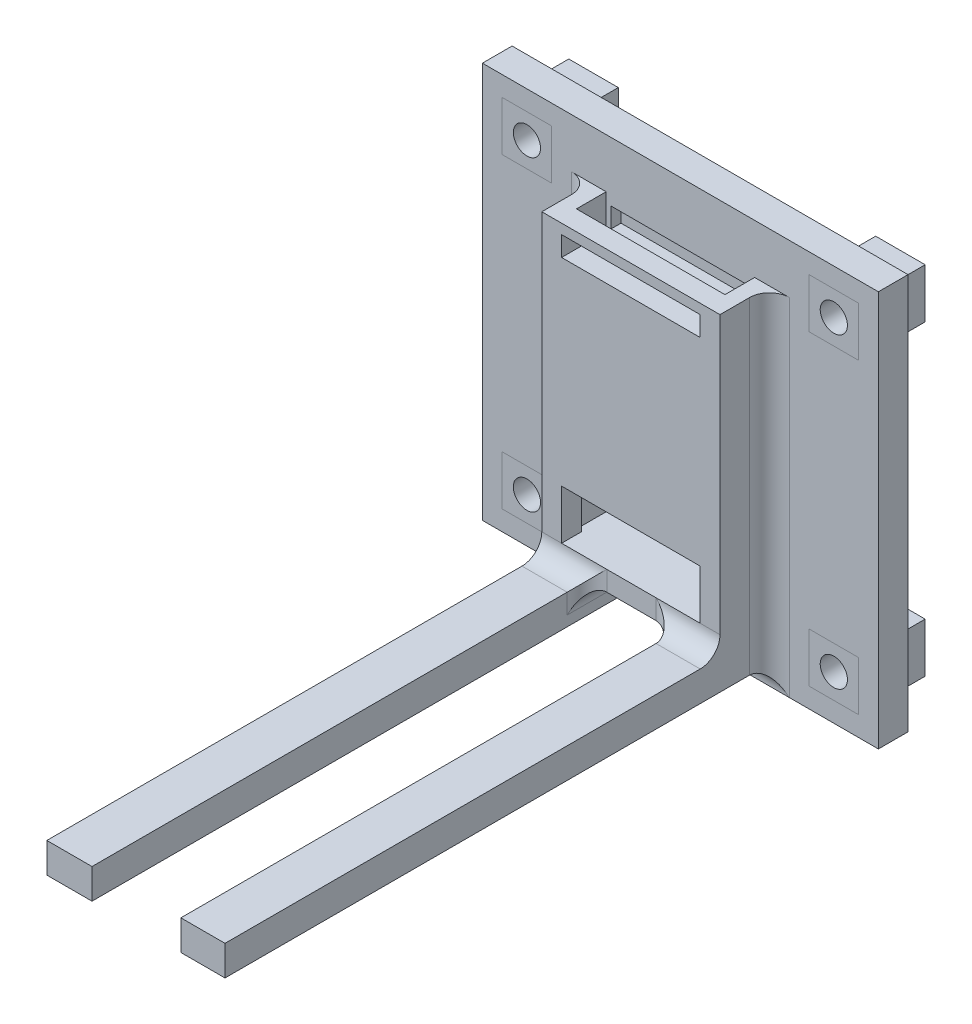
from build123d import *
from OCP.BRepAlgoAPI import BRepAlgoAPI_Cut
from OCP.TopTools import TopTools_ListOfShape

# Parameters (mm, degrees)
SKETCH1_W             = 40
SKETCH1_H             = 40
SKETCH1_W_2           = 5
SKETCH1_H_2           = 5
BOSS_EXTRUDE1_DEPTH   = 1.5
BOSS_EXTRUDE2_START   = 1.5
SKETCH1_3_W           = 5
SKETCH1_3_H           = 5
SKETCH1_3_R           = 1.375
BOSS_EXTRUDE2_DEPTH   = 6.728027623
BOSS_EXTRUDE2_2_DEPTH = 6.728027623
BOSS_EXTRUDE2_3_DEPTH = 6.728027623
BOSS_EXTRUDE2_4_DEPTH = 6.728027623
SKETCH2_W             = 18
SKETCH2_H             = 5
BOSS_EXTRUDE3_DEPTH   = 15
CUT_EXTRUDE1_START    = -13
SKETCH2_3_W           = 15
SKETCH2_3_H           = 3
CUT_EXTRUDE1_DEPTH    = 28
BOSS_EXTRUDE4_START   = 1.5
SKETCH5_W             = 4.563741623
SKETCH5_H             = 3.034118579
SKETCH5_W_2           = 4.459037602
BOSS_EXTRUDE4_DEPTH   = 55
CUT_EXTRUDE2_START    = 6.5
SKETCH5_3_W           = 14
SKETCH5_3_H           = 2
CUT_EXTRUDE2_DEPTH    = 6
CUT_EXTRUDE3_START    = 6.5
SKETCH5_4_W           = 14
SKETCH5_4_H           = 5
CUT_EXTRUDE3_DEPTH    = 5
FILLET2_START         = -9
FILLET2_DEPTH         = 18
FILLET2_START_2       = -20.000000802
FILLET2_2_DEPTH       = 7.000000802
FILLET2_START_3       = -15
FILLET2_3_DEPTH       = 30
FILLET2_START_4       = -12
FILLET2_4_DEPTH       = 24
FILLET2_5_DEPTH       = 4.563741623
FILLET2_START_5       = 4.540962398
FILLET2_6_DEPTH       = 4.459037602
FILLET3_R             = 2


with BuildPart() as part:
    # Sketch1 → Boss-Extrude1 (new, symmetric)
    with BuildSketch(Plane.XY):
        Rectangle(SKETCH1_W, SKETCH1_H)
        with Locations((-15.5, -15.5)):
            Rectangle(SKETCH1_W_2, SKETCH1_H_2, mode=Mode.SUBTRACT)
        with Locations((15.5, -15.5)):
            Rectangle(SKETCH1_W_2, SKETCH1_H_2, mode=Mode.SUBTRACT)
        with Locations((15.5, 15.5)):
            Rectangle(SKETCH1_W_2, SKETCH1_H_2, mode=Mode.SUBTRACT)
        with Locations((-15.5, 15.5)):
            Rectangle(SKETCH1_W_2, SKETCH1_H_2, mode=Mode.SUBTRACT)
    extrude(amount=BOSS_EXTRUDE1_DEPTH, both=True)

    # Sketch2 → Boss-Extrude3 (add, symmetric)
    with BuildSketch(Plane(origin=(0, 0, 0), x_dir=(1, 0, 0), z_dir=(0, 1, 0))):
        with Locations((0, -4)):
            Rectangle(SKETCH2_W, SKETCH2_H)
    extrude(amount=BOSS_EXTRUDE3_DEPTH, both=True)

    # Sketch2<3> → Cut-Extrude1 (cut)
    with BuildSketch(Plane(origin=(0, 0, 0), x_dir=(1, 0, 0), z_dir=(0, 1, 0)).offset(CUT_EXTRUDE1_START)):
        with Locations((0, -3)):
            Rectangle(SKETCH2_3_W, SKETCH2_3_H)
    extrude(amount=CUT_EXTRUDE1_DEPTH, mode=Mode.SUBTRACT)

    # Sketch5 → Boss-Extrude4 (add)
    with BuildSketch(Plane.XY.offset(BOSS_EXTRUDE4_START)):
        with Locations((-6.718129189, -16.51705929)):
            Rectangle(SKETCH5_W, SKETCH5_H)
        with Locations((6.770481199, -16.51705929)):
            Rectangle(SKETCH5_W_2, SKETCH5_H)
    extrude(amount=BOSS_EXTRUDE4_DEPTH)

    # Sketch5<3> → Cut-Extrude2 (cut)
    with BuildSketch(Plane.XY.offset(CUT_EXTRUDE2_START)):
        with Locations((0, 13)):
            Rectangle(SKETCH5_3_W, SKETCH5_3_H)
    extrude(amount=-CUT_EXTRUDE2_DEPTH, mode=Mode.SUBTRACT)

    # Sketch5<4> → Cut-Extrude3 (cut)
    with BuildSketch(Plane.XY.offset(CUT_EXTRUDE3_START)):
        with Locations((0, -10.5)):
            Rectangle(SKETCH5_4_W, SKETCH5_4_H)
    extrude(amount=-CUT_EXTRUDE3_DEPTH, mode=Mode.SUBTRACT)


with BuildPart() as body_2:
    # Sketch1<3> → Boss-Extrude2 (new body)
    with BuildSketch(Plane.XY.offset(BOSS_EXTRUDE2_START)):
        with Locations((-15.5, -15.5)):
            Rectangle(SKETCH1_3_W, SKETCH1_3_H)
        with Locations((-15.5, -15.5)):
            Circle(SKETCH1_3_R, mode=Mode.SUBTRACT)
    extrude(amount=-BOSS_EXTRUDE2_DEPTH)


with BuildPart() as body_3:
    # Sketch1<3> → Boss-Extrude2 2 (new body)
    with BuildSketch(Plane.XY.offset(BOSS_EXTRUDE2_START)):
        with Locations((15.5, -15.5)):
            Rectangle(SKETCH1_3_W, SKETCH1_3_H)
        with Locations((15.5, -15.5)):
            Circle(SKETCH1_3_R, mode=Mode.SUBTRACT)
    extrude(amount=-BOSS_EXTRUDE2_2_DEPTH)


with BuildPart() as body_4:
    # Sketch1<3> → Boss-Extrude2 3 (new body)
    with BuildSketch(Plane.XY.offset(BOSS_EXTRUDE2_START)):
        with Locations((15.5, 15.5)):
            Rectangle(SKETCH1_3_W, SKETCH1_3_H)
        with Locations((15.5, 15.5)):
            Circle(SKETCH1_3_R, mode=Mode.SUBTRACT)
    extrude(amount=-BOSS_EXTRUDE2_3_DEPTH)


with BuildPart() as body_5:
    # Sketch1<3> → Boss-Extrude2 4 (new body)
    with BuildSketch(Plane.XY.offset(BOSS_EXTRUDE2_START)):
        with Locations((-15.5, 15.5)):
            Rectangle(SKETCH1_3_W, SKETCH1_3_H)
        with Locations((-15.5, 15.5)):
            Circle(SKETCH1_3_R, mode=Mode.SUBTRACT)
    extrude(amount=-BOSS_EXTRUDE2_4_DEPTH)


with BuildPart() as fillet2_tool:
    # Fillet2: read off the stored shape, not the designer's step
    # Fillet2 outline → Fillet2 (new body)
    with BuildSketch(Plane.YZ.offset(FILLET2_START)):
        with BuildLine():
            ThreePointArc((-15, 3.5), (-15.585786438, 2.085786438), (-17, 1.5))
            Line((-17, 1.5), (-15, 1.5))
            Line((-15, 1.5), (-15, 3.5))
        make_face()
    extrude(amount=FILLET2_DEPTH)


with BuildPart() as part_1:
    add(part.part)


with BuildPart() as part_2:
    # Fillet2: joined with fillet2_tool
    add(part_1.part.fuse(fillet2_tool.part, tol=0.00001))


with BuildPart() as fillet2_2_tool:
    # Fillet2 2 outline → Fillet2 2 (new body)
    with BuildSketch(Plane(origin=(0, 0, 0), x_dir=(1, 0, 0), z_dir=(0, 1, 0)).offset(FILLET2_START_2)):
        with BuildLine():
            ThreePointArc((-11, -1.5), (-9.585786438, -2.085786438), (-9, -3.5))
            Line((-9, -3.5), (-9, -6.5))
            Line((-9, -6.5), (-4.436258377, -6.5))
            Line((-4.436258377, -6.5), (-4.436258377, -3.5))
            ThreePointArc((-4.436258377, -3.5), (-3.85047194, -2.085786437), (-2.436258377, -1.5))
            Line((-2.436258377, -1.5), (-11, -1.5))
        make_face()
        with BuildLine():
            Line((4.540962398, -3.5), (4.540962398, -6.5))
            Line((4.540962398, -6.5), (9, -6.5))
            Line((9, -6.5), (9, -3.5))
            ThreePointArc((9, -3.5), (9.585786438, -2.085786438), (11, -1.5))
            Line((11, -1.5), (2.540962398, -1.5))
            ThreePointArc((2.540962398, -1.5), (3.95517596, -2.085786438), (4.540962398, -3.5))
        make_face()
    extrude(amount=FILLET2_2_DEPTH)


with BuildPart() as part_3:
    add(part_2.part)


with BuildPart() as part_4:
    # Fillet2 2: joined with fillet2_2_tool
    add(part_3.part.fuse(fillet2_2_tool.part, tol=0.00001))


with BuildPart() as fillet2_3_tool:
    # Fillet2 3 outline → Fillet2 3 (new body)
    with BuildSketch(Plane(origin=(0, 0, 0), x_dir=(1, 0, 0), z_dir=(0, 1, 0)).offset(FILLET2_START_3)):
        with BuildLine():
            ThreePointArc((-11, -1.5), (-9.585786438, -2.085786438), (-9, -3.5))
            Line((-9, -3.5), (-9, -1.5))
            Line((-9, -1.5), (-11, -1.5))
        make_face()
        with BuildLine():
            Line((9, -1.5), (9, -3.5))
            ThreePointArc((9, -3.5), (9.585786438, -2.085786438), (11, -1.5))
            Line((11, -1.5), (9, -1.5))
        make_face()
    extrude(amount=FILLET2_3_DEPTH)


with BuildPart() as part_5:
    add(part_4.part)


with BuildPart() as part_6:
    # Fillet2 3: joined with fillet2_3_tool
    add(part_5.part.fuse(fillet2_3_tool.part, tol=0.00001))


with BuildPart() as fillet2_4_tool:
    # Fillet2 4 outline → Fillet2 4 (new body)
    with BuildSketch(Plane.YZ.offset(FILLET2_START_4)):
        with BuildLine():
            ThreePointArc((-20, 1.5), (-18.607893288, 2.097610025), (-18.034118579, 3.499708959))
            Line((-18.034118579, 3.499708959), (-18.034118579, 6.5))
            Line((-18.034118579, 6.5), (-20.000000802, 6.5))
            Line((-20.000000802, 6.5), (-20, 1.5))
        make_face()
    extrude(amount=FILLET2_4_DEPTH)


with BuildPart() as part_7:
    add(part_6.part)

    # Fillet2 4: cut by fillet2_4_tool, with a tolerance
    fillet2_4_stock = TopTools_ListOfShape()
    fillet2_4_stock.Append(part_7.part.wrapped)
    fillet2_4_tools = TopTools_ListOfShape()
    fillet2_4_tools.Append(fillet2_4_tool.part.wrapped)
    fillet2_4_cut = BRepAlgoAPI_Cut()
    fillet2_4_cut.SetArguments(fillet2_4_stock)
    fillet2_4_cut.SetTools(fillet2_4_tools)
    fillet2_4_cut.SetFuzzyValue(0.00001)
    fillet2_4_cut.Build()
    add(Compound.cast(fillet2_4_cut.Shape()).solids(), mode=Mode.REPLACE)


with BuildPart() as fillet2_5_tool:
    # Fillet2 5 outline → Fillet2 5 (new body)
    with BuildSketch(Plane.YZ.offset(FILLET2_START)):
        with BuildLine():
            Line((-15, 6.5), (-13, 6.5))
            ThreePointArc((-13, 6.5), (-14.414213562, 7.085786438), (-15, 8.5))
            Line((-15, 8.5), (-15, 6.5))
        make_face()
    extrude(amount=FILLET2_5_DEPTH)


with BuildPart() as part_8:
    add(part_7.part)


with BuildPart() as part_9:
    # Fillet2 5: joined with fillet2_5_tool
    add(part_8.part.fuse(fillet2_5_tool.part, tol=0.00001))


with BuildPart() as fillet2_6_tool:
    # Fillet2 6 outline → Fillet2 6 (new body)
    with BuildSketch(Plane.YZ.offset(FILLET2_START_5)):
        with BuildLine():
            Line((-15, 6.5), (-13, 6.5))
            ThreePointArc((-13, 6.5), (-14.414213562, 7.085786438), (-15, 8.5))
            Line((-15, 8.5), (-15, 6.5))
        make_face()
    extrude(amount=FILLET2_6_DEPTH)


with BuildPart() as part_10:
    add(part_9.part)


with BuildPart() as part_11:
    # Fillet2 6: joined with fillet2_6_tool
    add(part_10.part.fuse(fillet2_6_tool.part, tol=0.00001))

    # Fillet3
    # the kernel refuses this fillet: 2 mm, written as the material it adds along each edge
    with BuildSketch(Plane(origin=(-2.436258377, -17, 3.5), x_dir=(0, 1, 0), z_dir=(-1, 0, 0))) as fillet3_piece_1_section:
        Polygon((0, 0), (FILLET3_R * 1.02, 0), (FILLET3_R * 1.02, FILLET3_R * 1.02), (0, FILLET3_R * 1.02), align=None)
    fillet3_piece_1 = extrude(amount=FILLET3_R * 1.02, mode=Mode.PRIVATE)
    fillet3_piece_1 = fillet3_piece_1 - Plane(origin=(-2.436258377, -17, 3.5), x_dir=(0, -0.7071067811865475, 0.7071067811865475), z_dir=(-1, 0, 0)) * Sphere(FILLET3_R, mode=Mode.PRIVATE)
    add(fillet3_piece_1)
    with BuildSketch(Plane(origin=(2.540962398, -17, 3.5), x_dir=(0, 1, 0), z_dir=(1, 0, 0))) as fillet3_piece_2_section:
        Polygon((0, 0), (FILLET3_R * 1.02, 0), (FILLET3_R * 1.02, -FILLET3_R * 1.02), (0, -FILLET3_R * 1.02), align=None)
    fillet3_piece_2 = extrude(amount=FILLET3_R * 1.02, mode=Mode.PRIVATE)
    fillet3_piece_2 = fillet3_piece_2 - Plane(origin=(2.540962398, -17, 3.5), x_dir=(0, -0.7071067811865475, 0.7071067811865475), z_dir=(1, 0, 0)) * Sphere(FILLET3_R, mode=Mode.PRIVATE)
    add(fillet3_piece_2)
    with BuildSketch(Plane(origin=(-4.436258377, -15, 3.5), x_dir=(6.810330077655635e-11, -1.0, 0), z_dir=(0, 0, 1))) as fillet3_piece_3:
        with BuildLine():
            CenterArc((FILLET3_R, FILLET3_R), FILLET3_R, 179.999999996, 90)
            Line((FILLET3_R * 6.81033007812e-11, FILLET3_R), (0, 0))
            Line((0, 0), (FILLET3_R, 0))
        make_face()
    extrude(amount=3)
    with BuildSketch(Plane(origin=(4.540962398, -15, 3.5), x_dir=(5.859757123971576e-12, -1.0, 0), z_dir=(0, 0, 1))) as fillet3_piece_4:
        with BuildLine():
            CenterArc((FILLET3_R, -FILLET3_R), FILLET3_R, 90, 90)
            Line((0, -FILLET3_R), (0, 0))
            Line((0, 0), (FILLET3_R, 0))
        make_face()
    extrude(amount=3)
    with BuildSketch(Plane(origin=(4.540962398, -15, 6.5), x_dir=(-1, 0, 0), z_dir=(0, 1, 0))) as fillet3_piece_5_section:
        with BuildLine():
            CenterArc((FILLET3_R, FILLET3_R), FILLET3_R, 180, 90)
            Line((0, FILLET3_R), (0, 0))
            Line((0, 0), (FILLET3_R, 0))
        make_face()
    fillet3_piece_5 = extrude(amount=2, mode=Mode.PRIVATE)
    fillet3_piece_5 = fillet3_piece_5 - Plane(origin=(4.540962398, -12.999999999, 8.500000001), x_dir=(0, -6.36912744361302e-10, -1.0), z_dir=(-1, 0, 0)) * Cylinder(2.000000001, 12, mode=Mode.PRIVATE)
    add(fillet3_piece_5)
    with BuildSketch(Plane(origin=(-4.436258377, -15, 6.5), x_dir=(1, 0, 0), z_dir=(0, 1, 0))) as fillet3_piece_6_section:
        with BuildLine():
            CenterArc((FILLET3_R, -FILLET3_R), FILLET3_R, 90, 90)
            Line((0, -FILLET3_R), (0, 0))
            Line((0, 0), (FILLET3_R, 0))
        make_face()
    fillet3_piece_6 = extrude(amount=2, mode=Mode.PRIVATE)
    fillet3_piece_6 = fillet3_piece_6 - Plane(origin=(-4.436258377, -12.999999999, 8.500000001), x_dir=(0, -6.36912744361302e-10, -1.0), z_dir=(-1, 0, 0)) * Cylinder(2.000000001, 12, mode=Mode.PRIVATE)
    add(fillet3_piece_6)
    with BuildSketch(Plane(origin=(-4.436258377, -20, 6.5), x_dir=(1, 0, 0), z_dir=(0, 1, 0))) as fillet3_piece_7a_section:
        with BuildLine():
            CenterArc((FILLET3_R, -FILLET3_R), FILLET3_R, 90, 90)
            Line((0, -FILLET3_R), (0, 0))
            Line((0, 0), (FILLET3_R, 0))
        make_face()
    fillet3_piece_7a = extrude(amount=7, mode=Mode.PRIVATE)
    fillet3_piece_7a = split(fillet3_piece_7a, bisect_by=Plane(origin=(-4.436258377, -18.034118579, 6.5), z_dir=(0, 1, 0)), keep=Keep.TOP, mode=Mode.PRIVATE)
    fillet3_piece_7a = split(fillet3_piece_7a, bisect_by=Plane(origin=(-4.436258377, -15, 6.5), z_dir=(0, -1, 0)), keep=Keep.TOP, mode=Mode.PRIVATE)
    with BuildSketch(Plane(origin=(-4.436258377, -15, 3.5), x_dir=(6.810330077655635e-11, -1.0, 0), z_dir=(0, 0, 1))) as fillet3_piece_7b_section:
        with BuildLine():
            CenterArc((FILLET3_R, FILLET3_R), FILLET3_R, 179.999999996, 90)
            Line((FILLET3_R * 6.81033007812e-11, FILLET3_R), (0, 0))
            Line((0, 0), (FILLET3_R, 0))
        make_face()
    fillet3_piece_7b = extrude(amount=8, mode=Mode.PRIVATE)
    fillet3_piece_7b = split(fillet3_piece_7b, bisect_by=Plane(origin=(-4.436258377, -15, 6.5), z_dir=(0, 0, 1)), keep=Keep.TOP, mode=Mode.PRIVATE)
    fillet3_piece_7 = fillet3_piece_7a & fillet3_piece_7b
    add(fillet3_piece_7)
    with BuildSketch(Plane(origin=(4.540962398, -20, 6.5), x_dir=(-1, 0, 0), z_dir=(0, 1, 0))) as fillet3_piece_8a_section:
        with BuildLine():
            CenterArc((FILLET3_R, FILLET3_R), FILLET3_R, 180, 90)
            Line((0, FILLET3_R), (0, 0))
            Line((0, 0), (FILLET3_R, 0))
        make_face()
    fillet3_piece_8a = extrude(amount=7, mode=Mode.PRIVATE)
    fillet3_piece_8a = split(fillet3_piece_8a, bisect_by=Plane(origin=(4.540962398, -18.034118579, 6.5), z_dir=(0, 1, 0)), keep=Keep.TOP, mode=Mode.PRIVATE)
    fillet3_piece_8a = split(fillet3_piece_8a, bisect_by=Plane(origin=(4.540962398, -15, 6.5), z_dir=(0, -1, 0)), keep=Keep.TOP, mode=Mode.PRIVATE)
    with BuildSketch(Plane(origin=(4.540962398, -15, 3.5), x_dir=(5.859757123971576e-12, -1.0, 0), z_dir=(0, 0, 1))) as fillet3_piece_8b_section:
        with BuildLine():
            CenterArc((FILLET3_R, -FILLET3_R), FILLET3_R, 90, 90)
            Line((0, -FILLET3_R), (0, 0))
            Line((0, 0), (FILLET3_R, 0))
        make_face()
    fillet3_piece_8b = extrude(amount=8, mode=Mode.PRIVATE)
    fillet3_piece_8b = split(fillet3_piece_8b, bisect_by=Plane(origin=(4.540962398, -15, 6.5), z_dir=(0, 0, 1)), keep=Keep.TOP, mode=Mode.PRIVATE)
    fillet3_piece_8 = fillet3_piece_8a & fillet3_piece_8b
    add(fillet3_piece_8)


solid = Compound([body_2.part, body_3.part, body_4.part, body_5.part, part_11.part])
